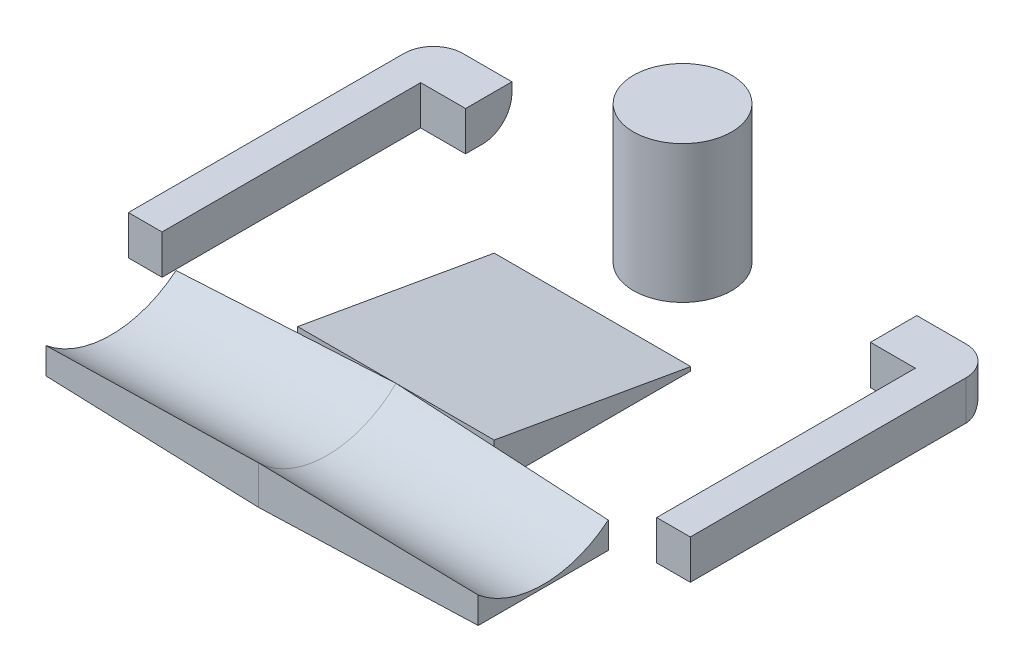
from build123d import *

# Parameters (mm, degrees)
BOSS_EXTRUDE1_DEPTH           = 20
BOSS_EXTRUDE1_2_DEPTH         = 20
FILLET1_R                     = 15
FILLET2_R                     = 15
BOSS_EXTRUDE2_DEPTH           = 50
SKETCH4_R                     = 25
BOSS_EXTRUDE3_DEPTH           = 70
BOSS_EXTRUDE4_DEPTH           = 110
BOSS_EXTRUDE4_DRAFT           = 1
BOSS_EXTRUDE4_OTHER_WAY_DEPTH = 110
BOSS_EXTRUDE4_OTHER_WAY_DRAFT = -1


with BuildPart() as part:
    # Sketch3 → Boss-Extrude1 (new body)
    with BuildSketch(Plane(origin=(0, 0, 0), x_dir=(1, 0, 0), z_dir=(0, 1, 0))):
        Polygon((-143, 248.331026124), (-143, 93.088162206), (-125.885057368, 93.088162206), (-125.885057368, 224.743736792), (-103.047296996, 224.743736792), (-103.047296996, 248.331026124), align=None)
    extrude(amount=BOSS_EXTRUDE1_DEPTH)

    # Fillet1
    fillet1_edges = [part.edges().sort_by_distance(p)[0] for p in [
        (-143, 10, -248.331026124),
        (-123.023648498, 0, -248.331026124),
    ]]
    fillet(fillet1_edges, radius=FILLET1_R)


with BuildPart() as body_2:
    # Sketch3 → Boss-Extrude1 2 (new body)
    with BuildSketch(Plane(origin=(0, 0, 0), x_dir=(1, 0, 0), z_dir=(0, 1, 0))):
        Polygon((125.885057368, 224.743736792), (125.885057368, 93.088162206), (143, 93.088162206), (143, 248.331026124), (103.047296996, 248.331026124), (103.047296996, 224.743736792), align=None)
    extrude(amount=BOSS_EXTRUDE1_2_DEPTH)

    # Fillet2
    fillet2_edges = [body_2.edges().sort_by_distance(p)[0] for p in [
        (143, 10, -248.331026124),
        (123.023648498, 0, -248.331026124),
    ]]
    fillet(fillet2_edges, radius=FILLET2_R)


with BuildPart() as body_3:
    # Sketch5 → Boss-Extrude2 (new, symmetric)
    with BuildSketch(Plane(origin=(0, 0, 0), x_dir=(0, 0, -1), z_dir=(1, 0, 0))):
        Polygon((86.252282078, 19.643991172), (86.252282078, 0), (186.316328437, 0), (186.316328437, 2), align=None)
    extrude(amount=BOSS_EXTRUDE2_DEPTH, both=True)


with BuildPart() as body_4:
    # Sketch4 → Boss-Extrude3 (new body)
    with BuildSketch(Plane(origin=(0, 0, 0), x_dir=(1, 0, 0), z_dir=(0, 1, 0))):
        with Locations(Location((0, 232.151552464, 0), (0, 0, 270))):
            Circle(SKETCH4_R)
    extrude(amount=BOSS_EXTRUDE3_DEPTH)


with BuildPart() as boss_extrude4_tool:
    # Sketch6 → Boss-Extrude4 (with draft: the straight prism first)
    with BuildSketch(Plane(origin=(0, 0, 0), x_dir=(0, 0, -1), z_dir=(1, 0, 0))):
        with BuildLine():
            Line((86.252282078, 0), (86.252282078, 19.643991172))
            ThreePointArc((86.252282078, 19.643991172), (51.24243699, 5.341480536), (16.232591902, 19.643991172))
            Line((16.232591902, 19.643991172), (16.232591902, 0))
            Line((16.232591902, 0), (86.252282078, 0))
        make_face()
    extrude(amount=BOSS_EXTRUDE4_DEPTH)
    # Boss-Extrude4: the draft: its side faces are tilted about the plane it starts from
    boss_extrude4_sides = [boss_extrude4_tool.faces().sort_by_distance(p)[0] for p in [
        (55, 9.821995586, -86.252282078),
        (55, 5.341480536, -51.24243699),
        (55, 9.821995586, -16.232591902),
        (55, 0, -51.24243699),
    ]]
    draft(boss_extrude4_sides, Plane(origin=(0, 0, 0), x_dir=(0, 0, -1), z_dir=(1, 0, 0)), BOSS_EXTRUDE4_DRAFT)


with BuildPart() as body_3_1:
    add(body_3.part)

    # Boss-Extrude4: add boss_extrude4_tool
    add(boss_extrude4_tool.part)


with BuildPart() as boss_extrude4_other_way_tool:
    # Sketch6 → Boss-Extrude4 other way (with draft: the straight prism first)
    with BuildSketch(Plane(origin=(0, 0, 0), x_dir=(0, 0, -1), z_dir=(1, 0, 0))):
        with BuildLine():
            Line((86.252282078, 0), (86.252282078, 19.643991172))
            ThreePointArc((86.252282078, 19.643991172), (51.24243699, 5.341480536), (16.232591902, 19.643991172))
            Line((16.232591902, 19.643991172), (16.232591902, 0))
            Line((16.232591902, 0), (86.252282078, 0))
        make_face()
    extrude(amount=-BOSS_EXTRUDE4_OTHER_WAY_DEPTH)
    # Boss-Extrude4 other way: the draft: its side faces are tilted about the plane it starts from
    boss_extrude4_other_way_sides = [boss_extrude4_other_way_tool.faces().sort_by_distance(p)[0] for p in [
        (-55, 9.821995586, -86.252282078),
        (-55, 5.341480536, -51.24243699),
        (-55, 9.821995586, -16.232591902),
        (-55, 0, -51.24243699),
    ]]
    draft(boss_extrude4_other_way_sides, Plane(origin=(0, 0, 0), x_dir=(0, 0, -1), z_dir=(1, 0, 0)), BOSS_EXTRUDE4_OTHER_WAY_DRAFT)


with BuildPart() as body_3_2:
    add(body_3_1.part)

    # Boss-Extrude4 other way: add boss_extrude4_other_way_tool
    add(boss_extrude4_other_way_tool.part)


solid = Compound([part.part, body_2.part, body_4.part, body_3_2.part])
